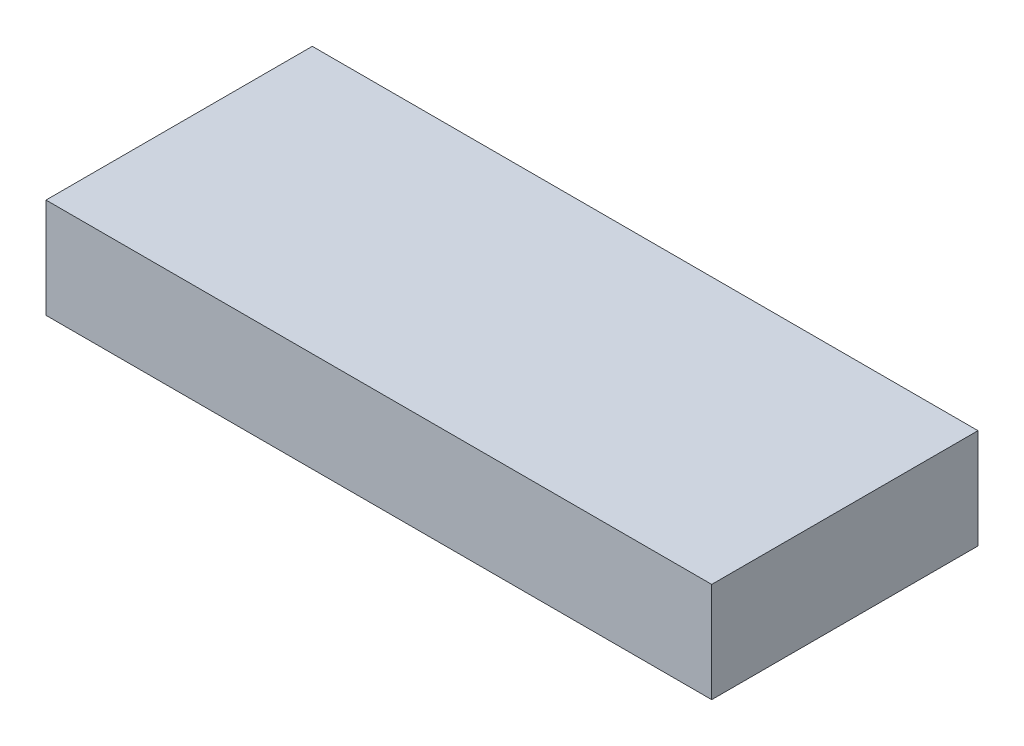
from build123d import *

# Parameters (mm, degrees)
SKETCH1_W           = 127
SKETCH1_H           = 50.8
BOSS_EXTRUDE1_DEPTH = 19.05


with BuildPart() as part:
    # Sketch1 → Boss-Extrude1 (new body)
    with BuildSketch(Plane(origin=(0, 0, 0), x_dir=(1, 0, 0), z_dir=(0, 1, 0))):
        with Locations((-63.5, 25.4)):
            Rectangle(SKETCH1_W, SKETCH1_H)
    extrude(amount=BOSS_EXTRUDE1_DEPTH)


solid = part.part
